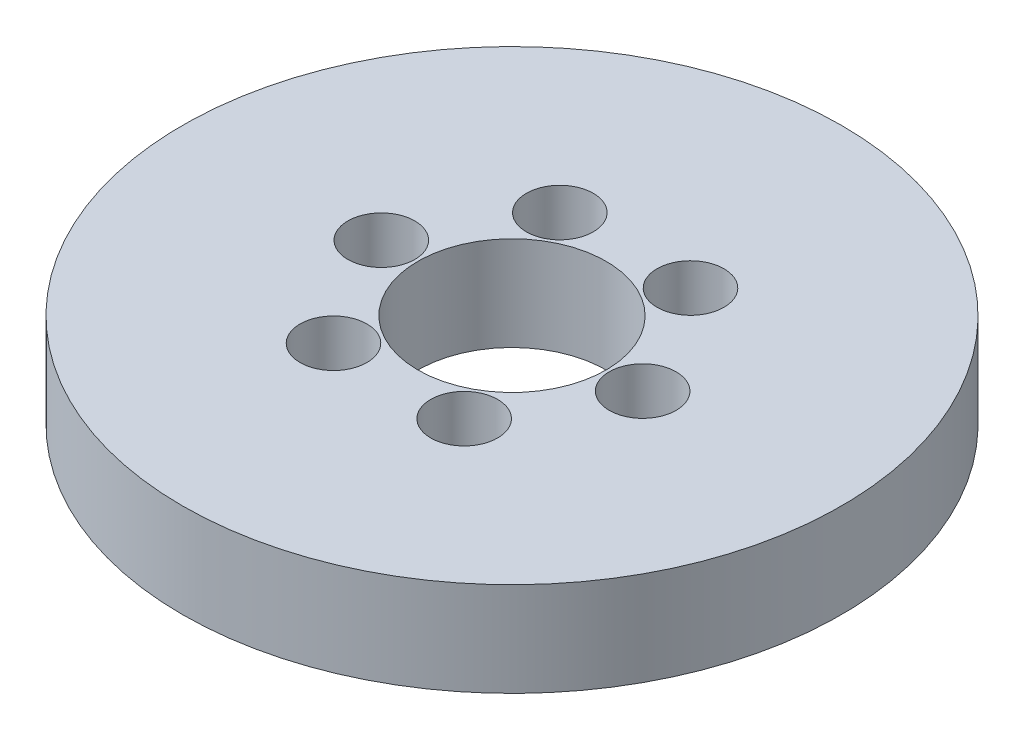
from build123d import *

# Parameters (mm, degrees)
SKETCH1_R           = 70
BOSS_EXTRUDE1_DEPTH = 20
SKETCH2_R           = 20
CUT_EXTRUDE1_DEPTH  = 101.995049384
SKETCH3_R           = 7.105797858
CUT_EXTRUDE2_DEPTH  = 12.372306178
CIRPATTERN1_COUNT   = 6


with BuildPart() as part:
    # Sketch1 → Boss-Extrude1 (new body)
    with BuildSketch(Plane(origin=(0, 0, 0), x_dir=(1, 0, 0), z_dir=(0, 1, 0))):
        Circle(SKETCH1_R)
    extrude(amount=BOSS_EXTRUDE1_DEPTH)

    # Sketch2 → Cut-Extrude1 (cut, through all)
    with BuildSketch(Plane(origin=(0, 0, 0), x_dir=(1, 0, 0), z_dir=(0, 1, 0))):
        Circle(SKETCH2_R)
    extrude(amount=CUT_EXTRUDE1_DEPTH, mode=Mode.SUBTRACT)

    # Sketch3 → Cut-Extrude2 (cut)
    with BuildSketch(Plane(origin=(0, 20, 0), x_dir=(1, 0, 0), z_dir=(0, 1, 0))):
        with Locations((-27.753811795, 0)):
            Circle(SKETCH3_R)
    cut_extrude2 = extrude(amount=-CUT_EXTRUDE2_DEPTH, mode=Mode.SUBTRACT)

    # CirPattern1: Cut-Extrude2 ×6 about axis
    cirpattern1_axis = Axis((0, 0, 0), (0, 1, 0))
    for i in range(1, CIRPATTERN1_COUNT):
        add(cut_extrude2.rotate(cirpattern1_axis, i * 360 / CIRPATTERN1_COUNT), mode=Mode.SUBTRACT)


solid = part.part
